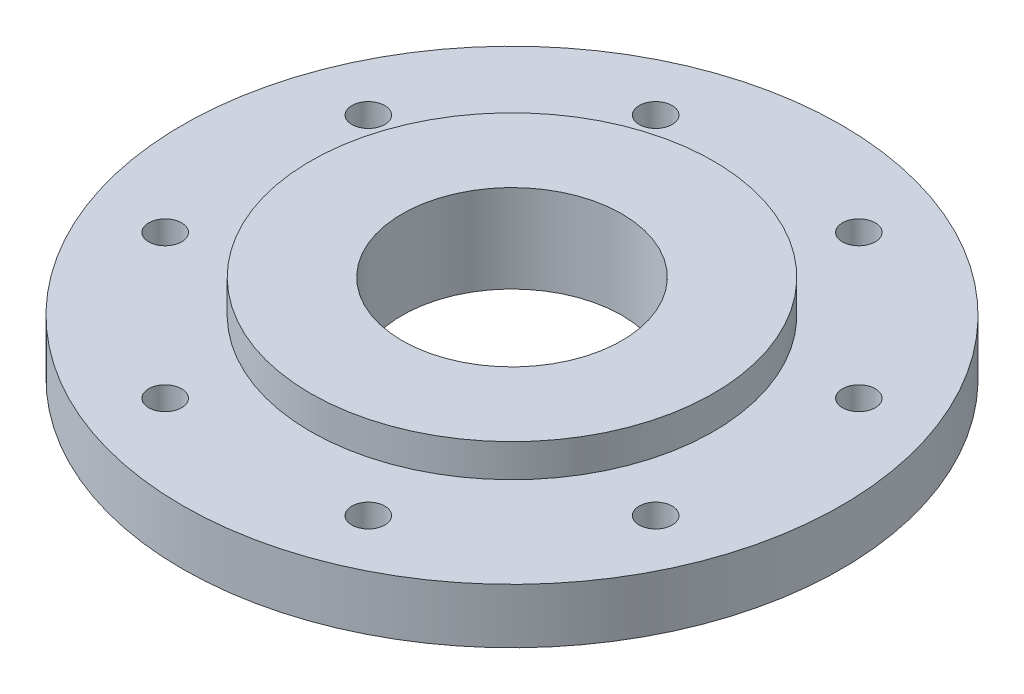
from build123d import *

# Parameters (mm, degrees)
F_01_FLANGE_PROFILE_R     = 180
F_01_FLANGE_PROFILE_R_2   = 60
F_01_FLANGE_PROFILE_R_3   = 9
F_01_FLANGE_EXTRUDE_DEPTH = 30
F_02_HUB_PROFILE_R        = 110
F_02_HUB_PROFILE_R_2      = 60
F_02_LOCATING_HUB_DEPTH   = 48


with BuildPart() as part:
    # 01_Flange_Profile → 01_Flange_Extrude (new body)
    with BuildSketch(Plane(origin=(0, 0, 0), x_dir=(1, 0, 0), z_dir=(0, 1, 0))):
        Circle(F_01_FLANGE_PROFILE_R)
        Circle(F_01_FLANGE_PROFILE_R_2, mode=Mode.SUBTRACT)
        with Locations((133.962532214, 55.489097693)):
            Circle(F_01_FLANGE_PROFILE_R_3, mode=Mode.SUBTRACT)
        with Locations((55.489097693, 133.962532214)):
            Circle(F_01_FLANGE_PROFILE_R_3, mode=Mode.SUBTRACT)
        with Locations((-55.489097693, 133.962532214)):
            Circle(F_01_FLANGE_PROFILE_R_3, mode=Mode.SUBTRACT)
        with Locations((-133.962532214, 55.489097693)):
            Circle(F_01_FLANGE_PROFILE_R_3, mode=Mode.SUBTRACT)
        with Locations((-133.962532214, -55.489097693)):
            Circle(F_01_FLANGE_PROFILE_R_3, mode=Mode.SUBTRACT)
        with Locations((-55.489097693, -133.962532214)):
            Circle(F_01_FLANGE_PROFILE_R_3, mode=Mode.SUBTRACT)
        with Locations((55.489097693, -133.962532214)):
            Circle(F_01_FLANGE_PROFILE_R_3, mode=Mode.SUBTRACT)
        with Locations((133.962532214, -55.489097693)):
            Circle(F_01_FLANGE_PROFILE_R_3, mode=Mode.SUBTRACT)
    extrude(amount=F_01_FLANGE_EXTRUDE_DEPTH)

    # 02_Hub_Profile → 02_Locating_Hub (add)
    with BuildSketch(Plane(origin=(0, 0, 0), x_dir=(1, 0, 0), z_dir=(0, 1, 0))):
        Circle(F_02_HUB_PROFILE_R)
        Circle(F_02_HUB_PROFILE_R_2, mode=Mode.SUBTRACT)
    extrude(amount=F_02_LOCATING_HUB_DEPTH)


solid = part.part
